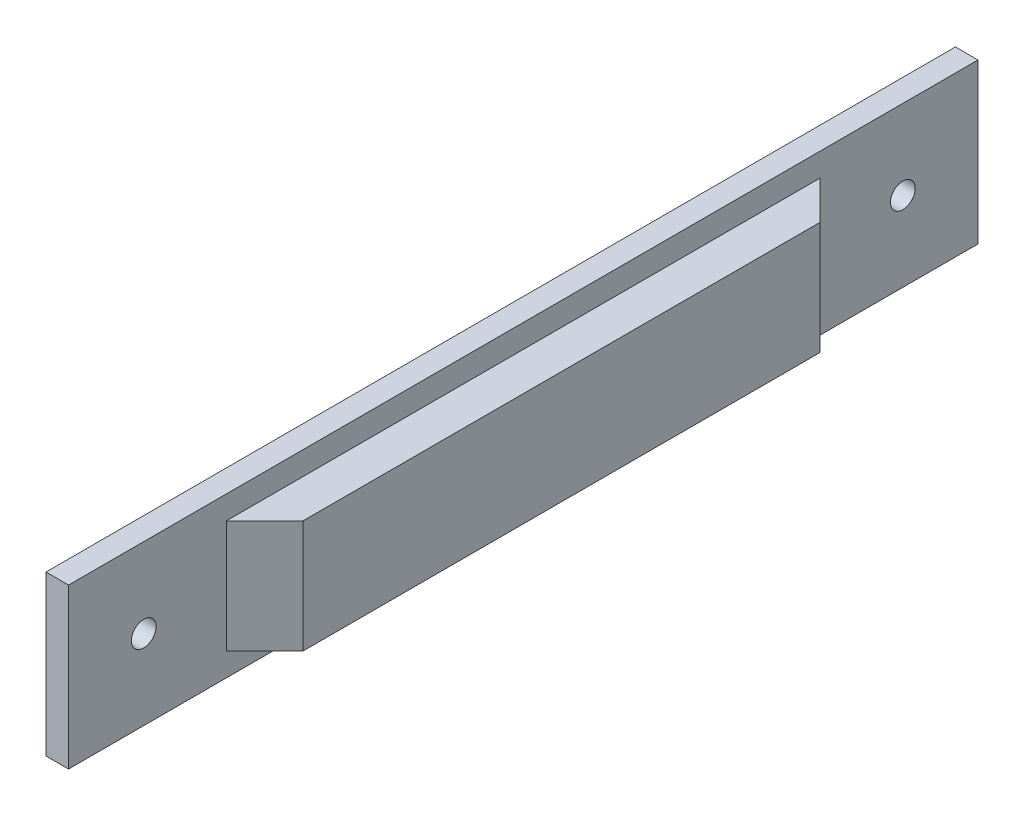
from build123d import *

# Parameters (mm, degrees)
SKETCH_1_W          = 21.2
SKETCH_1_H          = 21.2
SKETCH_1_W_2        = 15.2
SKETCH_1_H_2        = 15.2
EXTRUDE_1_DEPTH     = 121
SKETCH_2_R          = 1.65
CUT_EXTRUDE_1_DEPTH = 30
SKETCH_3_W          = 121
SKETCH_3_H          = 21.2
CUT_EXTRUDE_2_DEPTH = 18.2
SKETCH_4_W          = 68.8
SKETCH_4_H          = 15
EXTRUDE_1_2_DEPTH   = 5.1
CHAMFER_1_SIZE      = 5.1


with BuildPart() as part:
    # 草图1 → Extrude 1 (new body)
    with BuildSketch(Plane.XY):
        with Locations((7.6, 7.6)):
            Rectangle(SKETCH_1_W, SKETCH_1_H)
        with Locations((7.6, 7.6)):
            Rectangle(SKETCH_1_W_2, SKETCH_1_H_2, mode=Mode.SUBTRACT)
    extrude(amount=EXTRUDE_1_DEPTH)

    # 草图2 → 切除-拉伸1 (cut)
    with BuildSketch(Plane.ZY.offset(3)):
        with Locations((10, 7.6)):
            Circle(SKETCH_2_R)
        with Locations((111, 7.6)):
            Circle(SKETCH_2_R)
    extrude(amount=-CUT_EXTRUDE_1_DEPTH, mode=Mode.SUBTRACT)

    # 草图3 → 切除-拉伸2 (cut)
    with BuildSketch(Plane(origin=(18.2, 0, 0), x_dir=(0, 0, -1), z_dir=(1, 0, 0))):
        with Locations((-60.5, 7.6)):
            Rectangle(SKETCH_3_W, SKETCH_3_H)
    extrude(amount=-CUT_EXTRUDE_2_DEPTH, mode=Mode.SUBTRACT)

    # 草图4 → Extrude 1 2 (add)
    with BuildSketch(Plane(origin=(0, 0, 0), x_dir=(0, 0, -1), z_dir=(1, 0, 0))):
        with Locations((-60.5, 7.6)):
            Rectangle(SKETCH_4_W, SKETCH_4_H)
    extrude(amount=EXTRUDE_1_2_DEPTH)

    # 倒角1
    chamfer_1_edges = [part.edges().sort_by_distance(p)[0] for p in [
        (0, 7.6, 26.1),
        (0, 7.6, 94.9),
    ]]
    chamfer(chamfer_1_edges, length=CHAMFER_1_SIZE - 0.0001)  # a hair under: the kernel refuses the full size


solid = part.part
